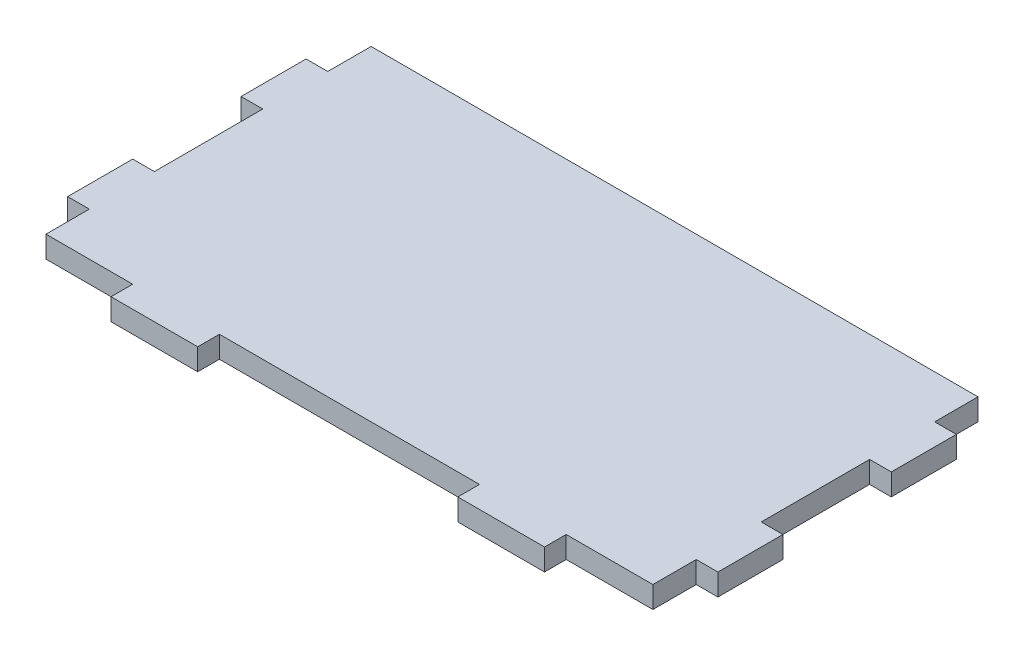
from build123d import *

# Parameters (mm, degrees)
BOSS_EXTRUDE1_DEPTH = 5


with BuildPart() as part:
    # Sketch1 → Boss-Extrude1 (new body)
    with BuildSketch(Plane(origin=(0, 0, 0), x_dir=(1, 0, 0), z_dir=(0, 1, 0))):
        Polygon((-70, 37.5), (-50, 37.5), (-30, 37.5), (30, 37.5), (50, 37.5), (70, 37.5), (70, 27.5), (75, 27.5), (75, 12.5), (70, 12.5), (70, -12.5), (75, -12.5), (75, -27.5), (70, -27.5), (70, -37.5), (50, -37.5), (50, -42.5), (30, -42.5), (30, -37.5), (-30, -37.5), (-30, -42.5), (-50, -42.5), (-50, -37.5), (-70, -37.5), (-70, -27.5), (-75, -27.5), (-75, -12.5), (-70, -12.5), (-70, 12.5), (-75, 12.5), (-75, 27.5), (-70, 27.5), align=None)
    extrude(amount=BOSS_EXTRUDE1_DEPTH)


solid = part.part
